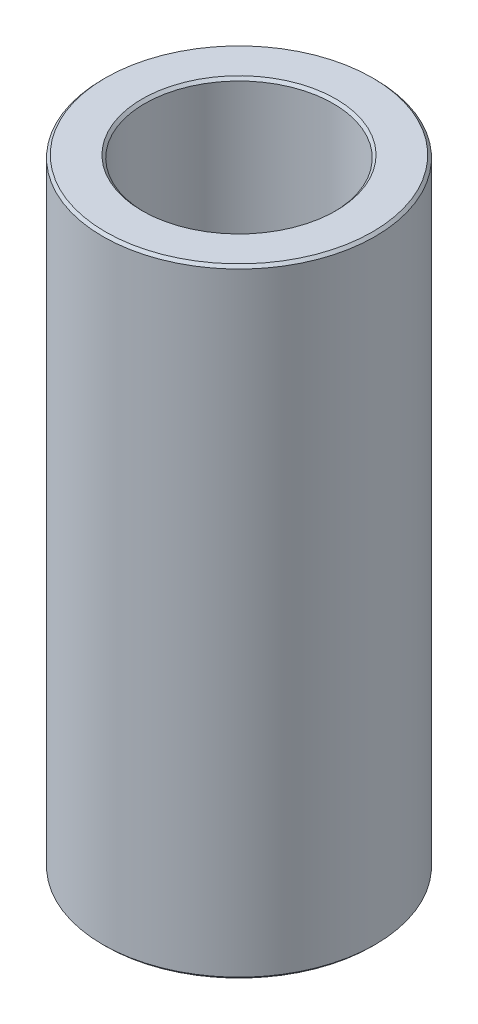
from build123d import *

# Parameters (mm, degrees)
SKETCH1_R           = 35
BOSS_EXTRUDE1_DEPTH = 159.038466395
SKETCH2_R           = 24.233919571
CUT_EXTRUDE1_DEPTH  = 167.563002475
CHAMFER1_SIZE       = 0.685858689


with BuildPart() as part:
    # Sketch1 → Boss-Extrude1 (new body)
    with BuildSketch(Plane(origin=(0, 0, 0), x_dir=(1, 0, 0), z_dir=(0, 1, 0))):
        Circle(SKETCH1_R)
    extrude(amount=BOSS_EXTRUDE1_DEPTH)

    # Sketch2 → Cut-Extrude1 (cut, through all)
    with BuildSketch(Plane(origin=(0, 0, 0), x_dir=(1, 0, 0), z_dir=(0, 1, 0))):
        Circle(SKETCH2_R)
    extrude(amount=CUT_EXTRUDE1_DEPTH, mode=Mode.SUBTRACT)

    # Chamfer1
    chamfer1_edges = [part.edges().sort_by_distance(p)[0] for p in [
        (-24.233919571, 159.038466395, 0),
        (-24.233919571, 0, 0),
        (-35, 0, 0),
        (-35, 159.038466395, 0),
    ]]
    chamfer(chamfer1_edges, length=CHAMFER1_SIZE)


solid = part.part
